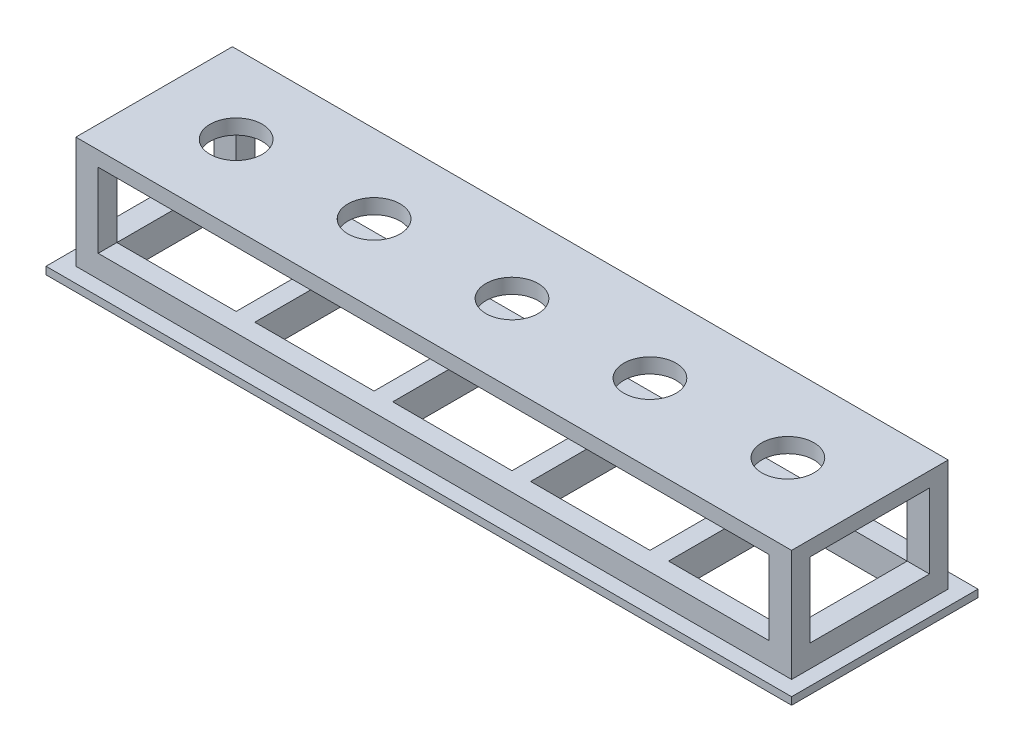
from build123d import *

# Parameters (mm, degrees)
SKETCH1_W               = 96
SKETCH1_H               = 21
BOSS_EXTRUDE1_DEPTH     = 3
CUT_EXTRUDE3_DEPTH      = 7
CUT_EXTRUDE3_DEPTH_BACK = 7
SKETCH2_W               = 16
SKETCH2_H               = 16
SKETCH5_W               = 3
SKETCH5_H               = 2.5
BOSS_EXTRUDE5_DEPTH     = 10
SKETCH6_W               = 96
SKETCH6_H               = 21
BOSS_EXTRUDE6_DEPTH     = 2
SKETCH7_R               = 3.5
CUT_EXTRUDE5_DEPTH      = 2
SKETCH9_W               = 100
SKETCH9_H               = 25
BOSS_EXTRUDE7_DEPTH     = 1
SKETCH10_W              = 16
SKETCH10_H              = 16
CUT_EXTRUDE6_DEPTH      = 1


with BuildPart() as part:
    # Sketch1 → Boss-Extrude1 (new body)
    with BuildSketch(Plane(origin=(0, 0, 0), x_dir=(1, 0, 0), z_dir=(0, 1, 0))):
        Rectangle(SKETCH1_W, SKETCH1_H)
    extrude(amount=BOSS_EXTRUDE1_DEPTH)

    # Sketch2 → Cut-Extrude3 (cut, two sides: drawn at the far end of the back side and taken through both)
    with BuildSketch(Plane(origin=(0, 3, 0), x_dir=(1, 0, 0), z_dir=(0, 1, 0)).offset(-CUT_EXTRUDE3_DEPTH_BACK)):
        Rectangle(SKETCH2_W, SKETCH2_H)
        with Locations((-37, 0)):
            Rectangle(SKETCH2_W, SKETCH2_H)
        with Locations((-18.5, 0)):
            Rectangle(SKETCH2_W, SKETCH2_H)
        with Locations((18.5, 0)):
            Rectangle(SKETCH2_W, SKETCH2_H)
        with Locations((37, 0)):
            Rectangle(SKETCH2_W, SKETCH2_H)
    extrude(amount=CUT_EXTRUDE3_DEPTH + CUT_EXTRUDE3_DEPTH_BACK, mode=Mode.SUBTRACT)

    # Sketch5 → Boss-Extrude5 (add)
    with BuildSketch(Plane(origin=(0, 3, 0), x_dir=(1, 0, 0), z_dir=(0, 1, 0))):
        with Locations((-46.5, 9.25)):
            Rectangle(SKETCH5_W, SKETCH5_H)
        with Locations((46.5, 9.25)):
            Rectangle(SKETCH5_W, SKETCH5_H)
        with Locations((-46.5, -9.25)):
            Rectangle(SKETCH5_W, SKETCH5_H)
        with Locations((46.5, -9.25)):
            Rectangle(SKETCH5_W, SKETCH5_H)
    extrude(amount=BOSS_EXTRUDE5_DEPTH)

    # Sketch6 → Boss-Extrude6 (add)
    with BuildSketch(Plane(origin=(0, 13, 0), x_dir=(1, 0, 0), z_dir=(0, 1, 0))):
        Rectangle(SKETCH6_W, SKETCH6_H)
    extrude(amount=BOSS_EXTRUDE6_DEPTH)

    # Sketch7 → Cut-Extrude5 (cut)
    with BuildSketch(Plane(origin=(0, 15, 0), x_dir=(1, 0, 0), z_dir=(0, 1, 0))):
        with Locations((-37, 0)):
            Circle(SKETCH7_R)
        with Locations((-18.5, 0)):
            Circle(SKETCH7_R)
        Circle(SKETCH7_R)
        with Locations((18.5, 0)):
            Circle(SKETCH7_R)
        with Locations((37, 0)):
            Circle(SKETCH7_R)
    extrude(amount=-CUT_EXTRUDE5_DEPTH, mode=Mode.SUBTRACT)

    # Sketch9 → Boss-Extrude7 (add)
    with BuildSketch(Plane.XZ):
        Rectangle(SKETCH9_W, SKETCH9_H)
    extrude(amount=BOSS_EXTRUDE7_DEPTH)

    # Sketch10 → Cut-Extrude6 (cut)
    with BuildSketch(Plane.XZ.offset(1)):
        with Locations((-37, 0)):
            Rectangle(SKETCH10_W, SKETCH10_H)
        with Locations((-18.5, 0)):
            Rectangle(SKETCH10_W, SKETCH10_H)
        Rectangle(SKETCH10_W, SKETCH10_H)
        with Locations((18.5, 0)):
            Rectangle(SKETCH10_W, SKETCH10_H)
        with Locations((37, 0)):
            Rectangle(SKETCH10_W, SKETCH10_H)
    extrude(amount=-CUT_EXTRUDE6_DEPTH, mode=Mode.SUBTRACT)


solid = part.part
